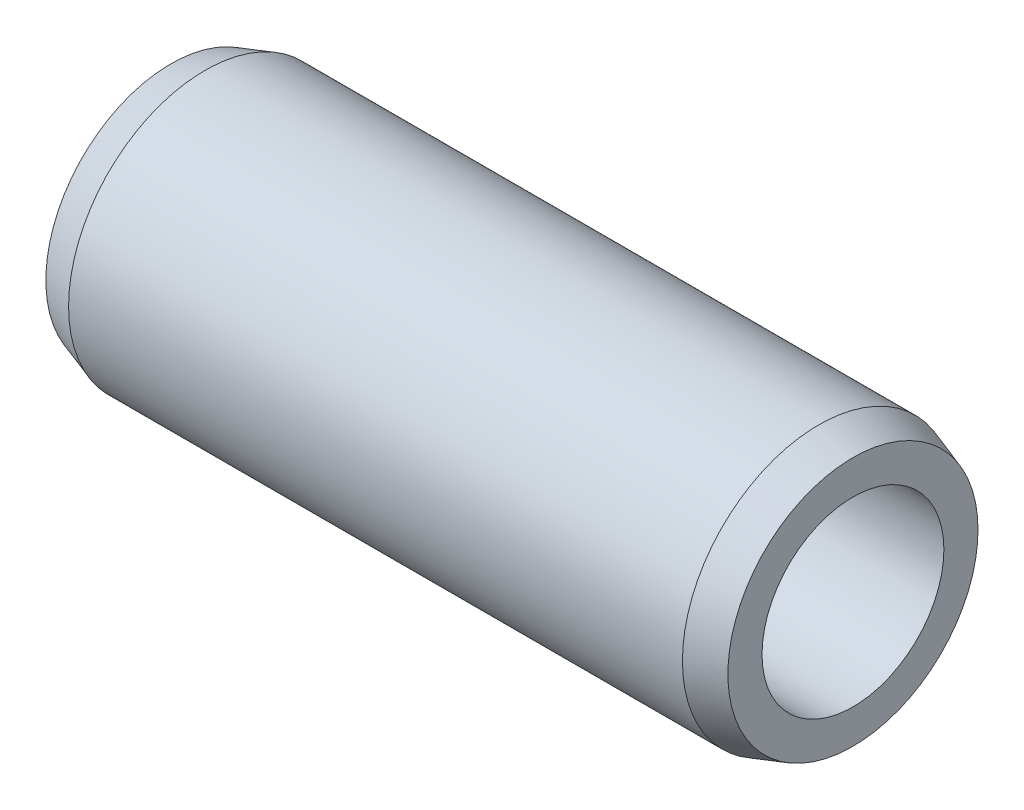
from build123d import *
from OCP.BRepFilletAPI import BRepFilletAPI_MakeChamfer

# Parameters (mm, degrees)
SKETCH1_R           = 6
SKETCH1_R_2         = 4
BOSS_EXTRUDE1_DEPTH = 30
CHAMFER2_SIZE       = 0.5
CHAMFER2_SIZE2      = 1.5


with BuildPart() as part:
    # Sketch1 → Boss-Extrude1 (new body)
    with BuildSketch(Plane(origin=(0, 0, 0), x_dir=(0, 0, -1), z_dir=(1, 0, 0))):
        Circle(SKETCH1_R)
        Circle(SKETCH1_R_2, mode=Mode.SUBTRACT)
    extrude(amount=BOSS_EXTRUDE1_DEPTH)

    # Chamfer2: one chamfer whose edges measure the first distance from different faces: ONE call of the kernel's chamfer builder (chamfer() names one face for all edges)
    chamfer2_edges_1 = [part.edges().sort_by_distance(p)[0] for p in [
        (30, 0, 6),
    ]]
    chamfer2_side_1 = [part.faces().sort_by_distance(p)[0] for p in [
        (30, 0, 5.830294373),
    ]]
    chamfer2_edges_2 = [part.edges().sort_by_distance(p)[0] for p in [
        (0, 0, 6),
    ]]
    chamfer2_side_2 = [part.faces().sort_by_distance(p)[0] for p in [
        (0, 0, 5.830294373),
    ]]
    chamfer2 = BRepFilletAPI_MakeChamfer(part.part.solid().wrapped)
    for e in chamfer2_edges_1:
        chamfer2.Add(CHAMFER2_SIZE, CHAMFER2_SIZE2, e.wrapped, chamfer2_side_1[0].wrapped)  # the first distance lies on this face
    for e in chamfer2_edges_2:
        chamfer2.Add(CHAMFER2_SIZE, CHAMFER2_SIZE2, e.wrapped, chamfer2_side_2[0].wrapped)  # the first distance lies on this face
    add(Compound.cast(chamfer2.Shape()), mode=Mode.REPLACE)


solid = part.part
